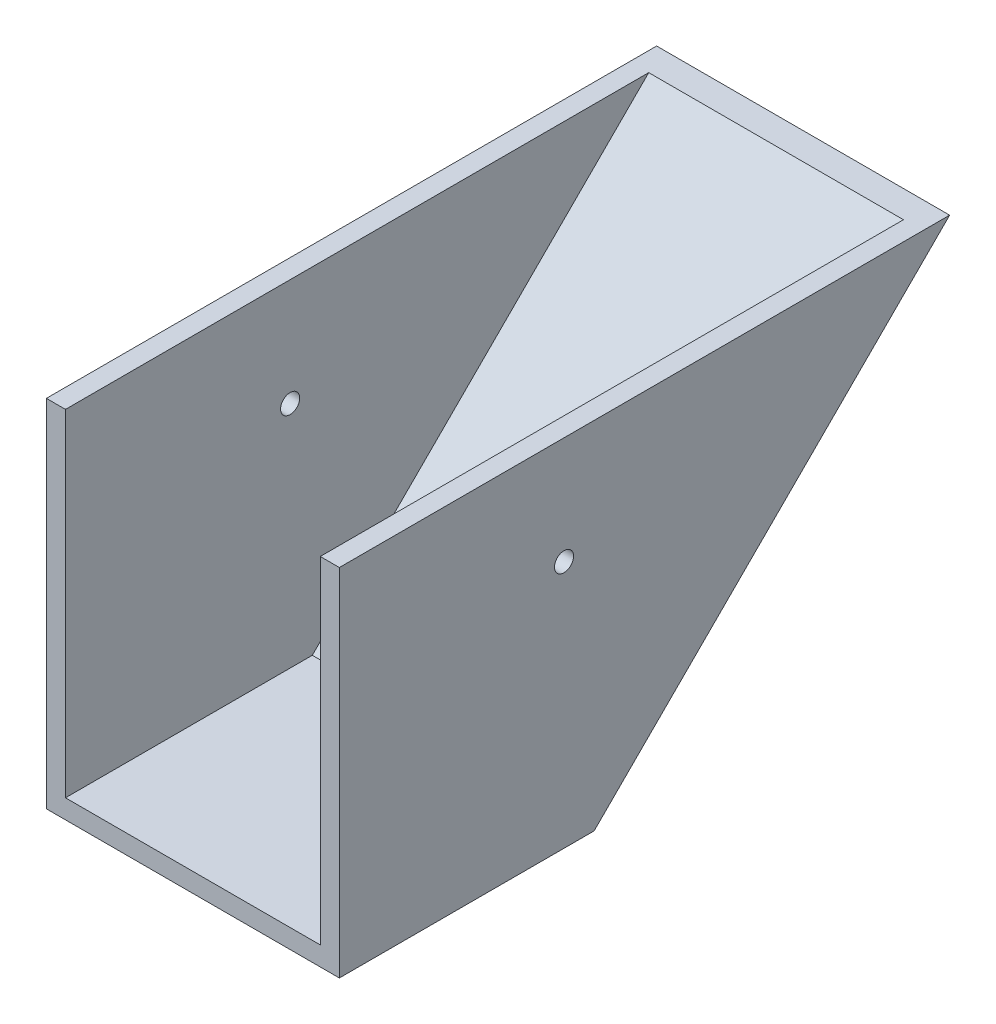
from build123d import *

# Parameters (mm, degrees)
SKETCH2_W           = 292.1
SKETCH2_H           = 635
BOSS_EXTRUDE1_DEPTH = 190.5
CUT_EXTRUDE2_DEPTH  = 381
SHELL1_T            = -19.05
SKETCH5_W           = 292.1
SKETCH5_H           = 635
CUT_EXTRUDE3_DEPTH  = 24.892
SKETCH6_R           = 9.525
CUT_EXTRUDE4_DEPTH  = 514.096
SKETCH10_W          = 292.1
SKETCH10_H          = 610.108
CUT_EXTRUDE7_DEPTH  = 1.693333333


with BuildPart() as part:
    # Sketch2 → Boss-Extrude1 (new, symmetric)
    with BuildSketch(Plane(origin=(0, 0, 0), x_dir=(1, 0, 0), z_dir=(0, 1, 0))):
        Rectangle(SKETCH2_W, SKETCH2_H)
    extrude(amount=BOSS_EXTRUDE1_DEPTH, both=True)

    # Sketch4 → Cut-Extrude2 (cut)
    with BuildSketch(Plane.ZY.offset(146.05)):
        Polygon((-317.5, 190.5), (63.5, -190.5), (-317.5, -190.5), align=None)
    extrude(amount=-CUT_EXTRUDE2_DEPTH, mode=Mode.SUBTRACT)

    # Shell1
    shell1_openings = [part.faces().sort_by_distance(p)[0] for p in [
        (0, 0, 317.5),
    ]]
    offset(amount=SHELL1_T, openings=shell1_openings, kind=Kind.INTERSECTION)

    # Sketch5 → Cut-Extrude3 (cut)
    with BuildSketch(Plane(origin=(0, 190.5, 0), x_dir=(1, 0, 0), z_dir=(0, 1, 0))):
        Rectangle(SKETCH5_W, SKETCH5_H)
    extrude(amount=-CUT_EXTRUDE3_DEPTH, mode=Mode.SUBTRACT)

    # Sketch6 → Cut-Extrude4 (cut)
    with BuildSketch(Plane.ZY.offset(146.05)):
        with Locations((93.517292524, 56.961208915)):
            Circle(SKETCH6_R)
    extrude(amount=-CUT_EXTRUDE4_DEPTH, mode=Mode.SUBTRACT)

    # Sketch10 → Cut-Extrude7 (cut)
    with BuildSketch(Plane(origin=(0, 165.608, 0), x_dir=(1, 0, 0), z_dir=(0, 1, 0))):
        with Locations((0, -12.446)):
            Rectangle(SKETCH10_W, SKETCH10_H)
    extrude(amount=-CUT_EXTRUDE7_DEPTH, mode=Mode.SUBTRACT)


solid = part.part
